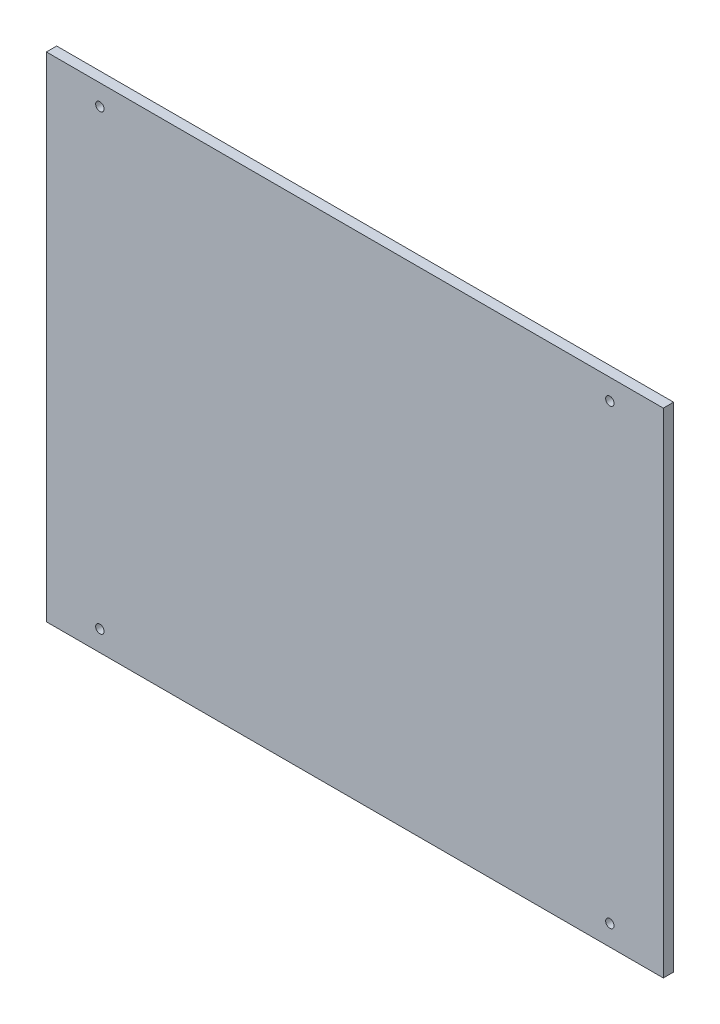
from build123d import *

# Parameters (mm, degrees)
ESQUISSE1_W        = 300
ESQUISSE1_H        = 240
ESQUISSE1_R        = 2.05
BOSS_EXTRU_1_DEPTH = 5


with BuildPart() as part:
    # Esquisse1 → Boss.-Extru.1 (new body)
    with BuildSketch(Plane.XY):
        Rectangle(ESQUISSE1_W, ESQUISSE1_H)
        with Locations((-124, 110)):
            Circle(ESQUISSE1_R, mode=Mode.SUBTRACT)
        with Locations((-124, -110)):
            Circle(ESQUISSE1_R, mode=Mode.SUBTRACT)
        with Locations((124, -110)):
            Circle(ESQUISSE1_R, mode=Mode.SUBTRACT)
        with Locations((124, 110)):
            Circle(ESQUISSE1_R, mode=Mode.SUBTRACT)
    extrude(amount=-BOSS_EXTRU_1_DEPTH)


solid = part.part
